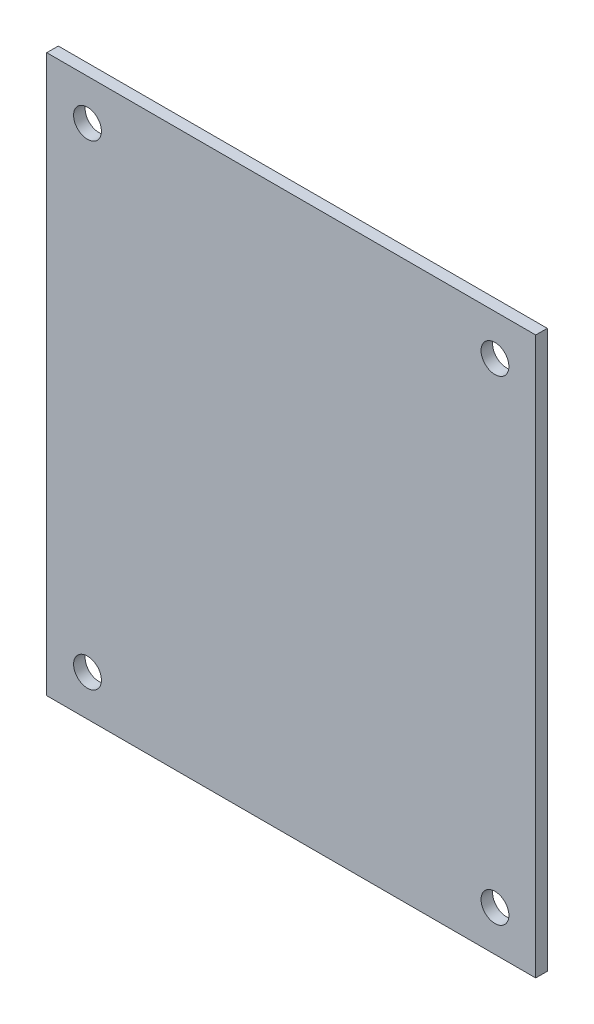
from build123d import *

# Parameters (mm, degrees)
SKETCH1_W           = 72
SKETCH1_H           = 82
BOSS_EXTRUDE1_DEPTH = 1.7
SKETCH2_R           = 2.05
CUT_EXTRUDE1_DEPTH  = 55.588368724


with BuildPart() as part:
    # Sketch1 → Boss-Extrude1 (new body)
    with BuildSketch(Plane.XY):
        Rectangle(SKETCH1_W, SKETCH1_H)
    extrude(amount=BOSS_EXTRUDE1_DEPTH)

    # Sketch2 → Cut-Extrude1 (cut, through all)
    with BuildSketch(Plane.XY.offset(1.7)):
        with Locations((-30, 35)):
            Circle(SKETCH2_R)
        with Locations((30, 35)):
            Circle(SKETCH2_R)
        with Locations((30, -35)):
            Circle(SKETCH2_R)
        with Locations((-30, -35)):
            Circle(SKETCH2_R)
    extrude(amount=-CUT_EXTRUDE1_DEPTH, mode=Mode.SUBTRACT)


solid = part.part
